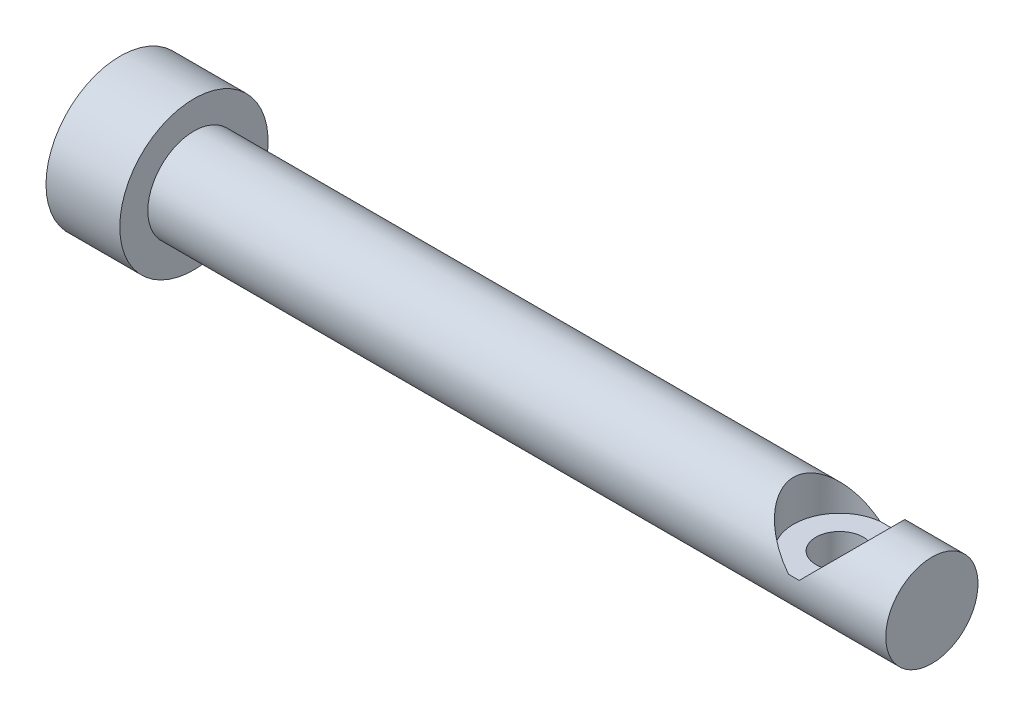
from build123d import *

# Parameters (mm, degrees)
CBORE_FOR_6_SOCKET_HEAD_CAP_SCREW1_D           = 4.0894
CBORE_FOR_6_SOCKET_HEAD_CAP_SCREW1_CBORE_D     = 7.9375
CBORE_FOR_6_SOCKET_HEAD_CAP_SCREW1_CBORE_DEPTH = 3.5052
BOSS_EXTRUDE1_START                            = 3.175
SKETCH7_R                                      = 3.96875
BOSS_EXTRUDE1_DEPTH                            = 3.175


with BuildPart() as part:
    # Sketch1 → Revolve1 (revolve)
    with BuildSketch(Plane.XY):
        Polygon((-46.0375, 40.64), (-46.0375, 47.02175), (-39.6875, 47.02175), (-39.6875, 44.60875), (20.6375, 44.60875), (20.6375, 40.64), align=None)
    revolve(axis=Axis((-56.202964931, 40.64, 0), (1, 0, 0)))

    # CBORE for #6 Socket Head Cap Screw1 (through all)
    with Locations(Plane(origin=(0, 44.60875, 0), x_dir=(1, 0, 0), z_dir=(0, 1, 0))):
        with Locations((15.875, 0)):
            CounterBoreHole(CBORE_FOR_6_SOCKET_HEAD_CAP_SCREW1_D / 2, CBORE_FOR_6_SOCKET_HEAD_CAP_SCREW1_CBORE_D / 2, CBORE_FOR_6_SOCKET_HEAD_CAP_SCREW1_CBORE_DEPTH)

    # Sketch7 → Boss-Extrude1 (add)
    with BuildSketch(Plane(origin=(20.6375, 0, 0), x_dir=(0, 0, -1), z_dir=(1, 0, 0)).offset(BOSS_EXTRUDE1_START)):
        with Locations((0, 40.64)):
            Circle(SKETCH7_R)
    extrude(amount=-BOSS_EXTRUDE1_DEPTH)


solid = part.part
